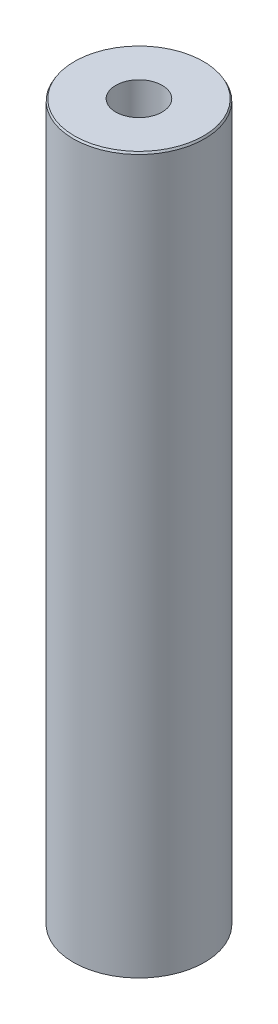
from build123d import *
from OCP.BRepFilletAPI import BRepFilletAPI_MakeChamfer

# Parameters (mm, degrees)
SKETCH1_R           = 55
BOSS_EXTRUDE1_DEPTH = 600
SKETCH2_R           = 19.440327968
CUT_EXTRUDE1_DEPTH  = 606.020660804
CHAMFER1_SIZE       = 1.620372752
CHAMFER1_SIZE2      = 0.935522645


with BuildPart() as part:
    # Sketch1 → Boss-Extrude1 (new body)
    with BuildSketch(Plane(origin=(0, 0, 0), x_dir=(1, 0, 0), z_dir=(0, 1, 0))):
        Circle(SKETCH1_R)
    extrude(amount=BOSS_EXTRUDE1_DEPTH)

    # Sketch2 → Cut-Extrude1 (cut, through all)
    with BuildSketch(Plane(origin=(0, 0, 0), x_dir=(1, 0, 0), z_dir=(0, 1, 0))):
        Circle(SKETCH2_R)
    extrude(amount=CUT_EXTRUDE1_DEPTH, mode=Mode.SUBTRACT)

    # Chamfer1: one chamfer whose edges measure the first distance from different faces: ONE call of the kernel's chamfer builder (chamfer() names one face for all edges)
    chamfer1_edges_1 = [part.edges().sort_by_distance(p)[0] for p in [
        (-55, 600, 0),
    ]]
    chamfer1_side_1 = [part.faces().sort_by_distance(p)[0] for p in [
        (-55, 300, 0),
    ]]
    chamfer1_edges_2 = [part.edges().sort_by_distance(p)[0] for p in [
        (-55, 0, 0),
    ]]
    chamfer1_side_2 = [part.faces().sort_by_distance(p)[0] for p in [
        (-53.444365081, 0, 0),
    ]]
    chamfer1 = BRepFilletAPI_MakeChamfer(part.part.solid().wrapped)
    for e in chamfer1_edges_1:
        chamfer1.Add(CHAMFER1_SIZE, CHAMFER1_SIZE2, e.wrapped, chamfer1_side_1[0].wrapped)  # the first distance lies on this face
    for e in chamfer1_edges_2:
        chamfer1.Add(CHAMFER1_SIZE, CHAMFER1_SIZE2, e.wrapped, chamfer1_side_2[0].wrapped)  # the first distance lies on this face
    add(Compound.cast(chamfer1.Shape()), mode=Mode.REPLACE)


solid = part.part
